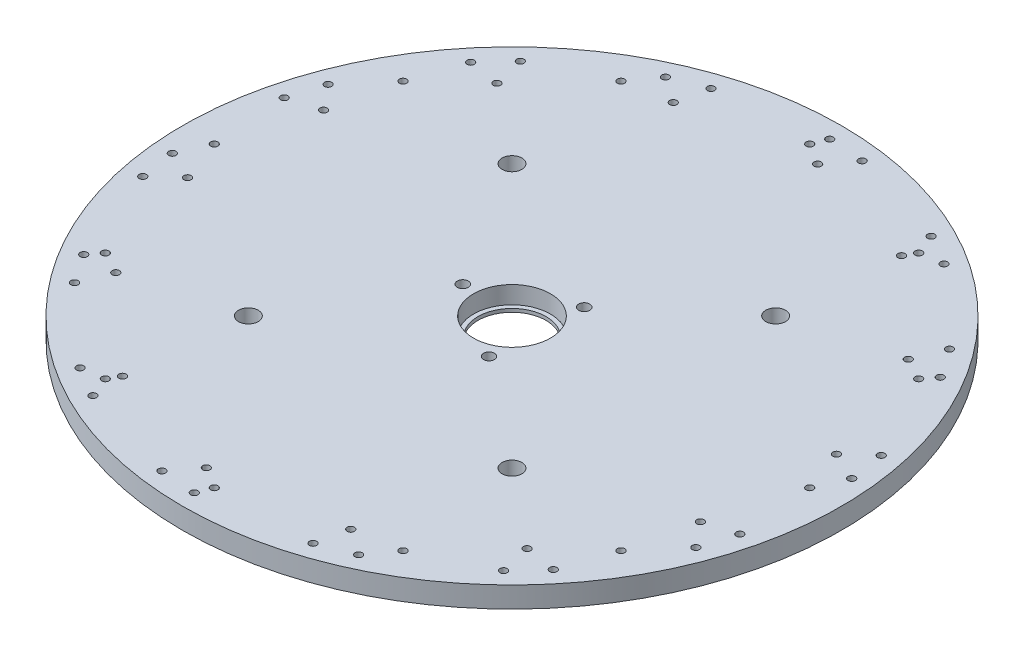
from build123d import *

# Parameters (mm, degrees)
SKETCH1_R           = 150
BOSS_EXTRUDE1_DEPTH = 9.52
SKETCH2_R           = 15.5
CUT_EXTRUDE1_DEPTH  = 213.345544808
SKETCH3_R           = 17.505
CUT_EXTRUDE2_DEPTH  = 8
SKETCH4_R           = 2.5
SKETCH4_R_2         = 1.65
CUT_EXTRUDE3_DEPTH  = 213.345544808
SKETCH6_R           = 1.65
CUT_EXTRUDE5_DEPTH  = 213.345544808
SKETCH7_R           = 4.5
CUT_EXTRUDE6_DEPTH  = 213.345544808


with BuildPart() as part:
    # Sketch1 → Boss-Extrude1 (new body)
    with BuildSketch(Plane(origin=(0, 0, 0), x_dir=(1, 0, 0), z_dir=(0, 1, 0))):
        Circle(SKETCH1_R)
    extrude(amount=BOSS_EXTRUDE1_DEPTH)

    # Sketch2 → Cut-Extrude1 (cut, through all)
    with BuildSketch(Plane(origin=(0, 9.52, 0), x_dir=(1, 0, 0), z_dir=(0, 1, 0))):
        Circle(SKETCH2_R)
    extrude(amount=-CUT_EXTRUDE1_DEPTH, mode=Mode.SUBTRACT)

    # Sketch3 → Cut-Extrude2 (cut)
    with BuildSketch(Plane(origin=(0, 9.52, 0), x_dir=(1, 0, 0), z_dir=(0, 1, 0))):
        Circle(SKETCH3_R)
    extrude(amount=-CUT_EXTRUDE2_DEPTH, mode=Mode.SUBTRACT)

    # Sketch4 → Cut-Extrude3 (cut, through all)
    with BuildSketch(Plane(origin=(0, 9.52, 0), x_dir=(1, 0, 0), z_dir=(0, 1, 0))):
        with Locations((10.725147849, -21.193217308)):
            Circle(SKETCH4_R)
        with Locations((-23.716438501, 1.308358157)):
            Circle(SKETCH4_R)
        with Locations((12.991290652, 19.884859151)):
            Circle(SKETCH4_R)
        with Locations((67.75, -117.346442213)):
            Circle(SKETCH4_R_2)
        with Locations((0, -135.5)):
            Circle(SKETCH4_R_2)
        with Locations((-67.75, -117.346442213)):
            Circle(SKETCH4_R_2)
        with Locations((-117.346442213, -67.75)):
            Circle(SKETCH4_R_2)
        with Locations((-135.5, 0)):
            Circle(SKETCH4_R_2)
        with Locations((-117.346442213, 67.75)):
            Circle(SKETCH4_R_2)
        with Locations((-67.75, 117.346442213)):
            Circle(SKETCH4_R_2)
        with Locations((0, 135.5)):
            Circle(SKETCH4_R_2)
        with Locations((67.75, 117.346442213)):
            Circle(SKETCH4_R_2)
        with Locations((117.346442213, 67.75)):
            Circle(SKETCH4_R_2)
        with Locations((135.5, 0)):
            Circle(SKETCH4_R_2)
        with Locations((117.346442213, -67.75)):
            Circle(SKETCH4_R_2)
    extrude(amount=-CUT_EXTRUDE3_DEPTH, mode=Mode.SUBTRACT)

    # Sketch6 → Cut-Extrude5 (cut, through all)
    with BuildSketch(Plane(origin=(0, 0, 0), x_dir=(-1, 0, 0), z_dir=(0, -1, 0))):
        with Locations((-63.964762127, 126.790217897)):
            Circle(SKETCH6_R)
        with Locations((-77.821168587, 118.790217897)):
            Circle(SKETCH6_R)
        with Locations((-64.892965357, 112.397913052)):
            Circle(SKETCH6_R)
        with Locations((-9.698914748, 129.423022928)):
            Circle(SKETCH6_R)
        with Locations((-2.618045494, 141.987309243)):
            Circle(SKETCH6_R)
        with Locations((-18.573306249, 140.791627746)):
            Circle(SKETCH6_R)
        with Locations((59.247207157, 129.062072633)):
            Circle(SKETCH6_R)
        with Locations((44.353227178, 134.907529023)):
            Circle(SKETCH6_R)
        with Locations((47.416124875, 120.814315845)):
            Circle(SKETCH6_R)
        with Locations((109.377823811, 90.574509696)):
            Circle(SKETCH6_R)
        with Locations((98.495060007, 102.303339645)):
            Circle(SKETCH6_R)
        with Locations((95.139819447, 88.276851818)):
            Circle(SKETCH6_R)
        with Locations((133.128738238, 49.436719183)):
            Circle(SKETCH6_R)
        with Locations((124.019905964, 38.255074644)):
            Circle(SKETCH6_R)
        with Locations((137.844821028, 34.14755429)):
            Circle(SKETCH6_R)
        with Locations((141.394637144, -13.221449816)):
            Circle(SKETCH6_R)
        with Locations((128.3363291, -19.343589231)):
            Circle(SKETCH6_R)
        with Locations((139.009960885, -29.042743035)):
            Circle(SKETCH6_R)
        with Locations((121.655594073, -73.260948528)):
            Circle(SKETCH6_R)
        with Locations((112.642473144, -86.480768917)):
            Circle(SKETCH6_R)
        with Locations((107.234168316, -73.111018025)):
            Circle(SKETCH6_R)
        with Locations((64.892965357, -112.397913052)):
            Circle(SKETCH6_R)
        with Locations((63.964762127, -126.790217897)):
            Circle(SKETCH6_R)
        with Locations((77.821168587, -118.790217897)):
            Circle(SKETCH6_R)
        with Locations((9.698914748, -129.423022928)):
            Circle(SKETCH6_R)
        with Locations((2.618045494, -141.987309243)):
            Circle(SKETCH6_R)
        with Locations((18.573306249, -140.791627746)):
            Circle(SKETCH6_R)
        with Locations((-44.353227178, -134.907529023)):
            Circle(SKETCH6_R)
        with Locations((-59.247207157, -129.062072633)):
            Circle(SKETCH6_R)
        with Locations((-47.416124875, -120.814315845)):
            Circle(SKETCH6_R)
        with Locations((-98.495060007, -102.303339645)):
            Circle(SKETCH6_R)
        with Locations((-109.377823811, -90.574509696)):
            Circle(SKETCH6_R)
        with Locations((-95.139819447, -88.276851818)):
            Circle(SKETCH6_R)
        with Locations((-124.019905964, -38.255074644)):
            Circle(SKETCH6_R)
        with Locations((-137.844821028, -34.14755429)):
            Circle(SKETCH6_R)
        with Locations((-133.128738238, -49.436719183)):
            Circle(SKETCH6_R)
        with Locations((-128.3363291, 19.343589231)):
            Circle(SKETCH6_R)
        with Locations((-141.394637144, 13.221449816)):
            Circle(SKETCH6_R)
        with Locations((-139.009960885, 29.042743035)):
            Circle(SKETCH6_R)
        with Locations((-107.234168316, 73.111018025)):
            Circle(SKETCH6_R)
        with Locations((-121.655594073, 73.260948528)):
            Circle(SKETCH6_R)
        with Locations((-112.642473144, 86.480768917)):
            Circle(SKETCH6_R)
    extrude(amount=-CUT_EXTRUDE5_DEPTH, mode=Mode.SUBTRACT)

    # Sketch7 → Cut-Extrude6 (cut, through all)
    with BuildSketch(Plane(origin=(0, 9.52, 0), x_dir=(1, 0, 0), z_dir=(0, 1, 0))):
        with Locations((-60, -60)):
            Circle(SKETCH7_R)
        with Locations((60, -60)):
            Circle(SKETCH7_R)
        with Locations((60, 60)):
            Circle(SKETCH7_R)
        with Locations((-60, 60)):
            Circle(SKETCH7_R)
    extrude(amount=-CUT_EXTRUDE6_DEPTH, mode=Mode.SUBTRACT)


solid = part.part
